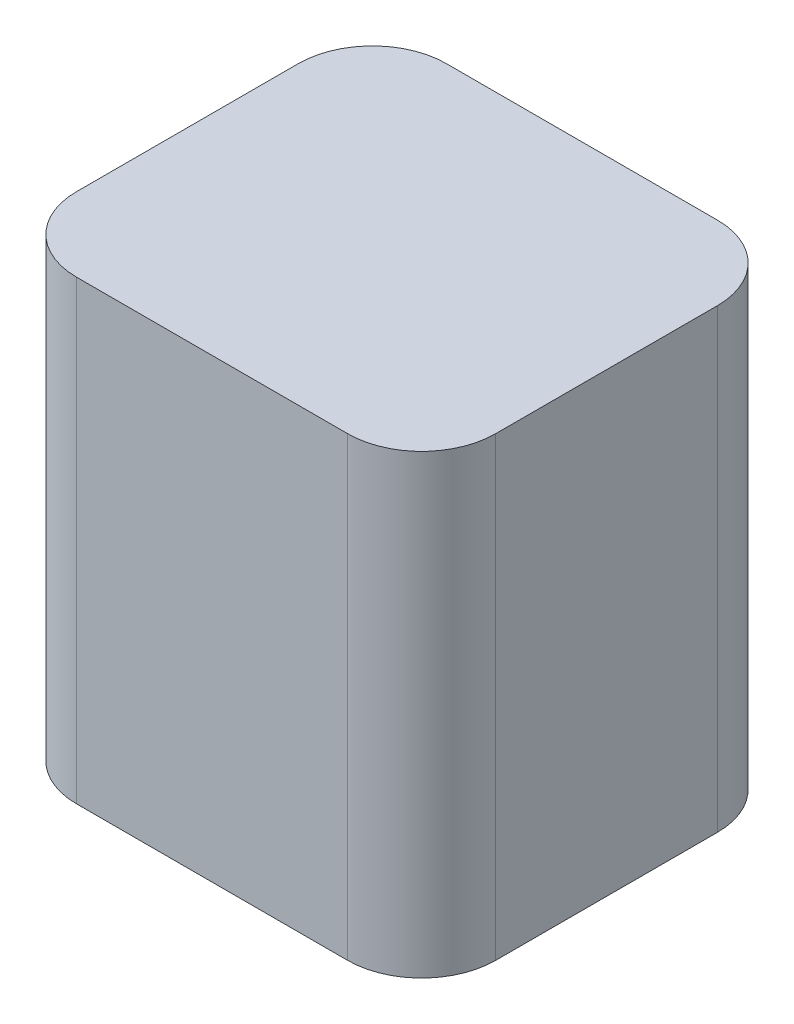
from build123d import *

# Parameters (mm, degrees)
SKETCH1_W           = 863.6
SKETCH1_H           = 762
BOSS_EXTRUDE1_DEPTH = 939.8
FILLET1_R           = 152.4


with BuildPart() as part:
    # Sketch1 → Boss-Extrude1 (new body)
    with BuildSketch(Plane(origin=(0, 0, 0), x_dir=(1, 0, 0), z_dir=(0, 1, 0))):
        Rectangle(SKETCH1_W, SKETCH1_H)
    extrude(amount=BOSS_EXTRUDE1_DEPTH)

    # Fillet1
    fillet1_edges = [part.edges().sort_by_distance(p)[0] for p in [
        (-431.8, 469.9, -381),
        (431.8, 469.9, -381),
        (431.8, 469.9, 381),
        (-431.8, 469.9, 381),
    ]]
    fillet(fillet1_edges, radius=FILLET1_R)


solid = part.part
